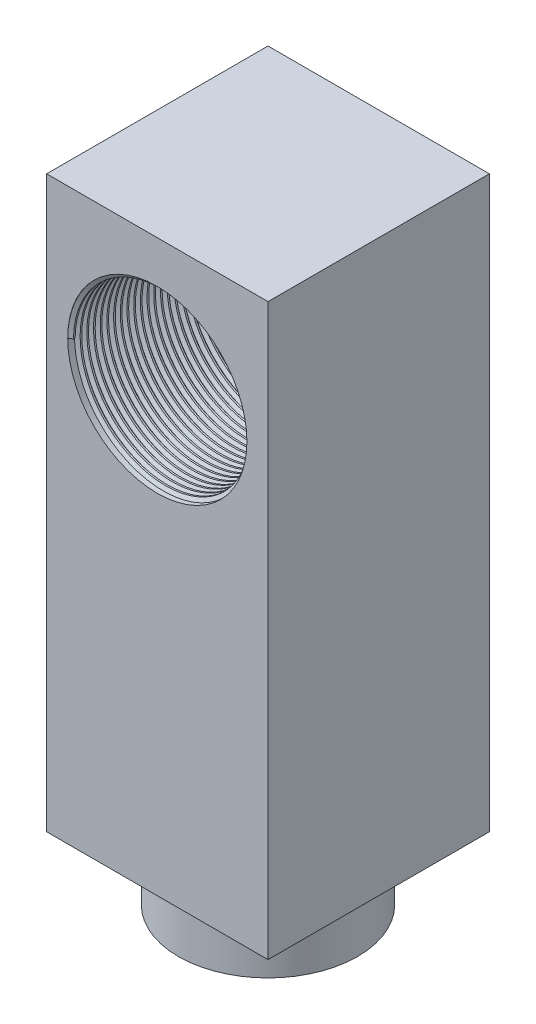
from build123d import *

# Parameters (mm, degrees)
SKETCH1_W           = 10.5
SKETCH1_H           = 10.5
BOSS_EXTRUDE3_DEPTH = 27.03
SKETCH13_R          = 4.25
BOSS_EXTRUDE4_DEPTH = 3
SKETCH14_R          = 4.25
CUT_EXTRUDE3_DEPTH  = 15
THREAD5_PITCH       = 0.3175


with BuildPart() as part:
    # Sketch1 → Boss-Extrude3 (new body)
    with BuildSketch(Plane(origin=(0, 0, 0), x_dir=(1, 0, 0), z_dir=(0, 1, 0))):
        Rectangle(SKETCH1_W, SKETCH1_H)
    extrude(amount=BOSS_EXTRUDE3_DEPTH)

    # Sketch13 → Boss-Extrude4 (add)
    with BuildSketch(Plane.XZ):
        with Locations(Location((0, 0, 0), (0, 0, 270))):
            Circle(SKETCH13_R)
    extrude(amount=BOSS_EXTRUDE4_DEPTH)

    # Sketch14 → Cut-Extrude3 (cut)
    with BuildSketch(Plane.XY.offset(5.25)):
        with Locations((0, 20.78)):
            Circle(SKETCH14_R)
    extrude(amount=-CUT_EXTRUDE3_DEPTH, mode=Mode.SUBTRACT)

    # Thread5: the profile of Thread Profile6 profile screwed along a right-hand helix of 32.283465 turns, 6 arcs to a turn; built about Z, then put on its axis
    thread5_z = Axis((0, 0, 0), (0, 0, 1))
    thread5_corners = [(4.2503, 0, -0.000173205), (4.2503, 0, 0.277985704), (4.078148085, 0, 0.17859375), (4.078148085, 0, 0.09921875)]
    with BuildLine(mode=Mode.PRIVATE) as thread5_profile:
        Line(thread5_corners[0], thread5_corners[1])
        Line(thread5_corners[1], thread5_corners[2])
        Line(thread5_corners[2], thread5_corners[3])
        Line(thread5_corners[3], thread5_corners[0])
    thread5_cap = Face(thread5_profile.wire())
    thread5_turn_angles = [0, 30, 60, 90, 120, 150, 180, 210, 240, 270, 300, 330, 360]
    thread5_turn_weights = [1, 0.8660254037844387, 1, 0.8660254037844387, 1, 0.8660254037844387, 1, 0.8660254037844387, 1, 0.8660254037844387, 1, 0.8660254037844387, 1]
    thread5_turn_rails = [Edge.make_bspline([Vector(p[0], p[1], 0).rotate(thread5_z, thread5_turn_angles[k]) / thread5_turn_weights[k] + Vector(0, 0, p[2] + THREAD5_PITCH * thread5_turn_angles[k] / 360) for k in range(13)], [0, 0, 0, 1, 1, 2, 2, 3, 3, 4, 4, 5, 5, 6, 6, 6], 2, thread5_turn_weights) for p in thread5_corners]
    thread5_turn_sides = [Face.make_surface_from_curves(thread5_turn_rails[p[0]], thread5_turn_rails[p[1]]) for p in [(0, 1), (1, 2), (2, 3), (3, 0)]]
    thread5_turn = Solid(Shell([*thread5_turn_sides, thread5_cap, thread5_cap.rotate(thread5_z, 360).moved(Location((0, 0, THREAD5_PITCH * 360 / 360)))]))
    thread5_last_angles = [11520, 11550, 11580, 11601.023622047, 11622.047244094]
    thread5_last_weights = [1, 0.8660254037844387, 1, 0.9334325983235251, 1]
    thread5_last_rails = [Edge.make_bspline([Vector(p[0], p[1], 0).rotate(thread5_z, thread5_last_angles[k]) / thread5_last_weights[k] + Vector(0, 0, p[2] + THREAD5_PITCH * thread5_last_angles[k] / 360) for k in range(5)], [0, 0, 0, 1, 1, 2, 2, 2], 2, thread5_last_weights) for p in thread5_corners]
    thread5_last_sides = [Face.make_surface_from_curves(thread5_last_rails[p[0]], thread5_last_rails[p[1]]) for p in [(0, 1), (1, 2), (2, 3), (3, 0)]]
    thread5_last = Solid(Shell([*thread5_last_sides, thread5_cap.rotate(thread5_z, 11520).moved(Location((0, 0, THREAD5_PITCH * 11520 / 360))), thread5_cap.rotate(thread5_z, 11622.047244094).moved(Location((0, 0, THREAD5_PITCH * 11622.047244094 / 360)))]))
    thread5_each = [*[thread5_turn.moved(Location((0, 0, THREAD5_PITCH * i))) for i in range(32)], thread5_last]
    add(Plane(origin=(0, 20.78, 5.25), x_dir=(-1, 0, 0), z_dir=(0, 0, -1)) * Compound([thread5_each[i] for i in range(0, 33, 2)]))
    add(Plane(origin=(0, 20.78, 5.25), x_dir=(-1, 0, 0), z_dir=(0, 0, -1)) * Compound([thread5_each[i] for i in range(1, 33, 2)]))


solid = part.part
